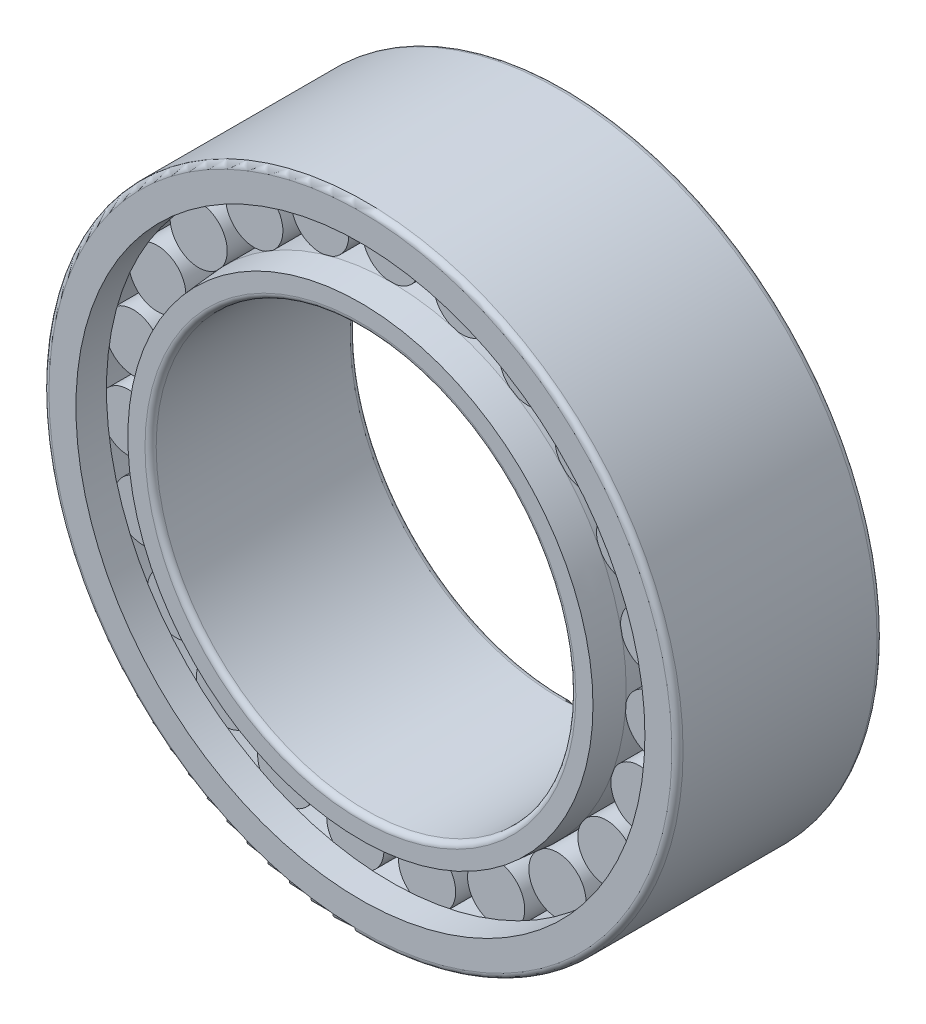
from build123d import *

# Parameters (mm, degrees)
BASESKE_W            = 15.4
BASESKE_H            = 3.066666667
FILLET1_R            = 0.6
CIRPATTERNBALL_COUNT = 23


with BuildPart() as part:
    # BaseSke → Roller (revolve)
    with BuildSketch(Plane(origin=(0, 0, 0), x_dir=(0, 0, -1), z_dir=(1, 0, 0))):
        with Locations((0, 26.716666667)):
            Rectangle(BASESKE_W, BASESKE_H)
    roller = revolve(axis=Axis((0, 28.25, 7.7), (0, 0, -1)))

    # OuterRaceSke → OuterRace (revolve)
    with BuildSketch(Plane(origin=(0, 0, 0), x_dir=(0, 0, -1), z_dir=(1, 0, 0))):
        Polygon((-11, 34), (11, 34), (11, 30.508), (7.725, 30.508), (7.725, 31.274666667), (-7.725, 31.274666667), (-7.725, 30.508), (-11, 30.508), align=None)
    revolve(axis=Axis((0, 0, 50.391616343), (0, 0, -1)))

    # InnerRaceSke → InnerRace (revolve)
    with BuildSketch(Plane(origin=(0, 0, 0), x_dir=(0, 0, -1), z_dir=(1, 0, 0))):
        Polygon((-11, 22.5), (11, 22.5), (11, 25.992), (7.725, 25.992), (7.725, 25.225333333), (-7.725, 25.225333333), (-7.725, 25.992), (-11, 25.992), align=None)
    revolve(axis=Axis((0, 0, 70.862590906), (0, 0, -1)))

    # Fillet1
    fillet1_edges = [part.edges().sort_by_distance(p)[0] for p in [
        (0, -22.5, 11),
        (0, -34, -11),
        (0, -34, 11),
        (0, -22.5, -11),
    ]]
    fillet(fillet1_edges, radius=FILLET1_R)

    # NJSke → NJ (revolve, cut)
    with BuildSketch(Plane(origin=(0, 0, 0), x_dir=(0, 0, -1), z_dir=(1, 0, 0))):
        Polygon((11, 25.992), (7.725, 25.992), (7.725, 25.225333333), (11, 24.93880796), align=None)
    nj = revolve(axis=Axis((0, 0, 35.607790457), (0, 0, -1)), mode=Mode.SUBTRACT)

    # NU: NJ across plane
    add(nj.mirror(Plane.XY), mode=Mode.SUBTRACT)

    # CirPatternBall: Roller ×23 about axis
    cirpatternball_axis = Axis((0, 0, 50.391616343), (0, 0, -1))
    for i in range(1, CIRPATTERNBALL_COUNT):
        add(roller.rotate(cirpatternball_axis, i * 360 / CIRPATTERNBALL_COUNT))


solid = part.part
